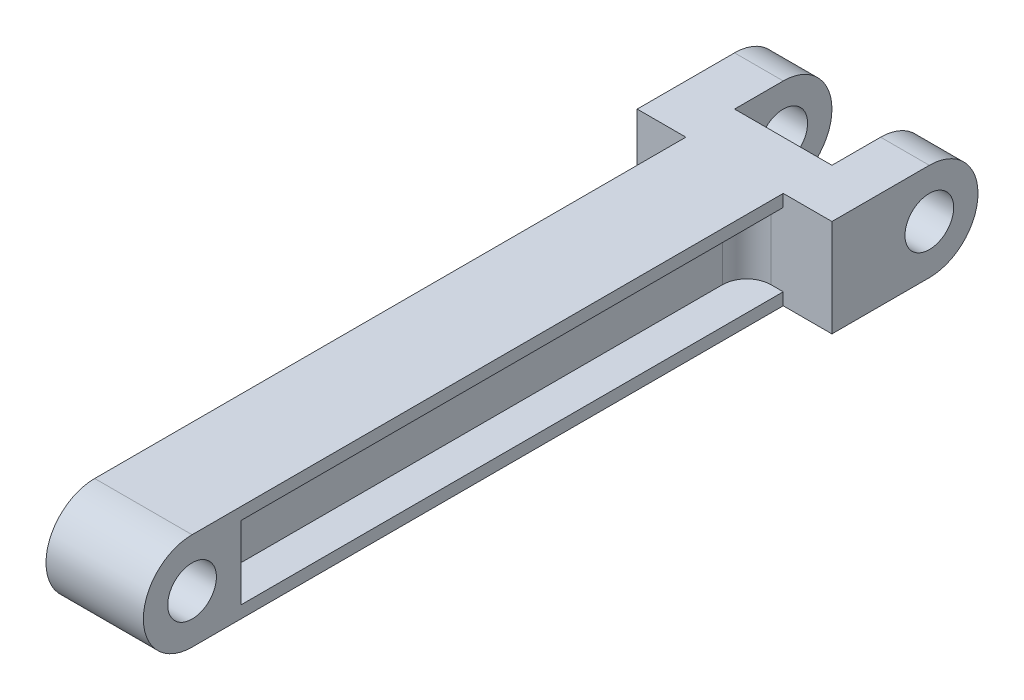
from build123d import *
from build123d.topology import SkipClean

# Parameters (mm, degrees)
SKETCH3_W           = 1.5875
SKETCH3_H           = 89.802561211
BOSS_EXTRUDE2_DEPTH = 12.7
BOSS_EXTRUDE4_DEPTH = 6.35
BOSS_EXTRUDE5_DEPTH = 12.7
BOSS_EXTRUDE6_START = -6.35
BOSS_EXTRUDE6_DEPTH = 6.35
CUT_EXTRUDE1_DEPTH  = 1.5875
SKETCH5_W           = 4.7625
SKETCH5_H           = 1.5875
BOSS_EXTRUDE7_DEPTH = 70.752561211
CUT_EXTRUDE2_DEPTH  = 12.7
FILLET1_R           = 3.175
FILLET2_R           = 3.175


# Read off the part's stored shape, not the designer's step: Mirror3
with BuildPart() as part:
    # Sketch3 → Boss-Extrude2 (new body)
    with BuildSketch(Plane(origin=(0, 0, 0), x_dir=(1, 0, 0), z_dir=(0, 1, 0))):
        with Locations((0.79375, 44.901280606)):
            Rectangle(SKETCH3_W, SKETCH3_H)
    extrude(amount=BOSS_EXTRUDE2_DEPTH)

    # Sketch4 → Boss-Extrude4 (add)
    with BuildSketch(Plane(origin=(1.5875, 0, 0), x_dir=(0, 0, -1), z_dir=(1, 0, 0))):
        with BuildLine():
            ThreePointArc((0, 0), (4.490128061, 1.859871939), (6.35, 6.35))
            ThreePointArc((6.35, 6.35), (4.490128061, 10.840128061), (0, 12.7))
            Line((0, 12.7), (0, 9.525))
            ThreePointArc((0, 9.525), (2.24506403, 8.59506403), (3.175, 6.35))
            ThreePointArc((3.175, 6.35), (2.24506403, 4.10493597), (0, 3.175))
            Line((0, 3.175), (0, 0))
        make_face()
        with BuildLine():
            Line((0, 9.525), (0, 12.7))
            ThreePointArc((0, 12.7), (-6.35, 6.35), (0, 0))
            Line((0, 0), (0, 3.175))
            ThreePointArc((0, 3.175), (-3.175, 6.35), (0, 9.525))
        make_face()
        with BuildLine():
            ThreePointArc((0, 0), (4.490128061, 1.859871939), (6.35, 6.35))
            ThreePointArc((6.35, 6.35), (4.490128061, 10.840128061), (0, 12.7))
            Line((0, 12.7), (0, 9.525))
            ThreePointArc((0, 9.525), (2.24506403, 8.59506403), (3.175, 6.35))
            ThreePointArc((3.175, 6.35), (2.24506403, 4.10493597), (0, 3.175))
            Line((0, 3.175), (0, 0))
        make_face()
        with BuildLine():
            Line((0, 9.525), (0, 12.7))
            ThreePointArc((0, 12.7), (-6.35, 6.35), (0, 0))
            Line((0, 0), (0, 3.175))
            ThreePointArc((0, 3.175), (-3.175, 6.35), (0, 9.525))
        make_face()
        with BuildLine():
            Line((6.35, 0), (6.35, 6.35))
            ThreePointArc((6.35, 6.35), (4.490128061, 1.859871939), (0, 0))
            Line((0, 0), (6.35, 0))
        make_face()
        with BuildLine():
            Line((6.35, 6.35), (6.35, 12.7))
            Line((6.35, 12.7), (0, 12.7))
            ThreePointArc((0, 12.7), (4.490128061, 10.840128061), (6.35, 6.35))
        make_face()
    extrude(amount=-BOSS_EXTRUDE4_DEPTH)

    # Sketch4<6> → Boss-Extrude5 (add)
    with BuildSketch(Plane(origin=(1.5875, 0, 0), x_dir=(0, 0, -1), z_dir=(1, 0, 0))):
        Polygon((83.452561211, 12.7), (77.102561211, 12.7), (77.102561211, 0), (83.452561211, 0), (83.452561211, 6.35), align=None)
    extrude(amount=-BOSS_EXTRUDE5_DEPTH)

    # Sketch4<7> → Boss-Extrude6 (add)
    with BuildSketch(Plane(origin=(1.5875, 0, 0), x_dir=(0, 0, -1), z_dir=(1, 0, 0)).offset(BOSS_EXTRUDE6_START)):
        with BuildLine():
            ThreePointArc((89.802561211, 12.7), (85.31243315, 10.840128061), (83.452561211, 6.35))
            ThreePointArc((83.452561211, 6.35), (85.31243315, 1.859871939), (89.802561211, 0))
            Line((89.802561211, 0), (89.802561211, 3.175))
            ThreePointArc((89.802561211, 3.175), (86.627561211, 6.35), (89.802561211, 9.525))
            Line((89.802561211, 9.525), (89.802561211, 12.7))
        make_face()
        with BuildLine():
            ThreePointArc((96.152561211, 6.35), (94.292689271, 10.840128061), (89.802561211, 12.7))
            Line((89.802561211, 12.7), (89.802561211, 9.525))
            ThreePointArc((89.802561211, 9.525), (92.047625241, 8.59506403), (92.977561211, 6.35))
            ThreePointArc((92.977561211, 6.35), (92.047625241, 4.10493597), (89.802561211, 3.175))
            Line((89.802561211, 3.175), (89.802561211, 0))
            ThreePointArc((89.802561211, 0), (94.292689271, 1.859871939), (96.152561211, 6.35))
        make_face()
        with BuildLine():
            ThreePointArc((89.802561211, 12.7), (85.31243315, 10.840128061), (83.452561211, 6.35))
            ThreePointArc((83.452561211, 6.35), (85.31243315, 1.859871939), (89.802561211, 0))
            Line((89.802561211, 0), (89.802561211, 3.175))
            ThreePointArc((89.802561211, 3.175), (86.627561211, 6.35), (89.802561211, 9.525))
            Line((89.802561211, 9.525), (89.802561211, 12.7))
        make_face()
        with BuildLine():
            ThreePointArc((96.152561211, 6.35), (94.292689271, 10.840128061), (89.802561211, 12.7))
            Line((89.802561211, 12.7), (89.802561211, 9.525))
            ThreePointArc((89.802561211, 9.525), (92.047625241, 8.59506403), (92.977561211, 6.35))
            ThreePointArc((92.977561211, 6.35), (92.047625241, 4.10493597), (89.802561211, 3.175))
            Line((89.802561211, 3.175), (89.802561211, 0))
            ThreePointArc((89.802561211, 0), (94.292689271, 1.859871939), (96.152561211, 6.35))
        make_face()
        with BuildLine():
            ThreePointArc((89.802561211, 0), (85.31243315, 1.859871939), (83.452561211, 6.35))
            Line((83.452561211, 6.35), (83.452561211, 0))
            Line((83.452561211, 0), (89.802561211, 0))
        make_face()
        with BuildLine():
            Line((89.802561211, 12.7), (83.452561211, 12.7))
            Line((83.452561211, 12.7), (83.452561211, 6.35))
            ThreePointArc((83.452561211, 6.35), (85.31243315, 10.840128061), (89.802561211, 12.7))
        make_face()
    extrude(amount=-BOSS_EXTRUDE6_DEPTH)

    # Sketch4<9> → Cut-Extrude1 (cut)
    with BuildSketch(Plane(origin=(1.5875, 0, 0), x_dir=(0, 0, -1), z_dir=(1, 0, 0))):
        with BuildLine():
            ThreePointArc((89.802561211, 0), (85.31243315, 1.859871939), (83.452561211, 6.35))
            Line((83.452561211, 6.35), (83.452561211, 0))
            Line((83.452561211, 0), (89.802561211, 0))
        make_face()
        with BuildLine():
            ThreePointArc((89.802561211, 12.7), (85.31243315, 10.840128061), (83.452561211, 6.35))
            ThreePointArc((83.452561211, 6.35), (85.31243315, 1.859871939), (89.802561211, 0))
            Line((89.802561211, 0), (89.802561211, 3.175))
            ThreePointArc((89.802561211, 3.175), (86.627561211, 6.35), (89.802561211, 9.525))
            Line((89.802561211, 9.525), (89.802561211, 12.7))
        make_face()
        with BuildLine():
            ThreePointArc((96.152561211, 6.35), (94.292689271, 10.840128061), (89.802561211, 12.7))
            Line((89.802561211, 12.7), (89.802561211, 9.525))
            ThreePointArc((89.802561211, 9.525), (92.047625241, 8.59506403), (92.977561211, 6.35))
            ThreePointArc((92.977561211, 6.35), (92.047625241, 4.10493597), (89.802561211, 3.175))
            Line((89.802561211, 3.175), (89.802561211, 0))
            ThreePointArc((89.802561211, 0), (94.292689271, 1.859871939), (96.152561211, 6.35))
        make_face()
        with BuildLine():
            Line((89.802561211, 12.7), (83.452561211, 12.7))
            Line((83.452561211, 12.7), (83.452561211, 6.35))
            ThreePointArc((83.452561211, 6.35), (85.31243315, 10.840128061), (89.802561211, 12.7))
        make_face()
    extrude(amount=-CUT_EXTRUDE1_DEPTH, mode=Mode.SUBTRACT)


with BuildPart() as cut_extrude1_kept_piece:
    # of the separate pieces the step leaves, the one the design keeps (cut_extrude1_pieces_kept)
    add(part.part.solids().sort_by_distance((1.5875, 0, 0))[0])

    # Sketch5 → Boss-Extrude7 (add)
    with BuildSketch(Plane(origin=(0, 0, -6.35), x_dir=(-1, 0, 0), z_dir=(0, 0, -1))):
        with Locations((2.38125, 11.90625)):
            Rectangle(SKETCH5_W, SKETCH5_H)
        with Locations((2.38125, 0.79375)):
            Rectangle(SKETCH5_W, SKETCH5_H)
    extrude(amount=BOSS_EXTRUDE7_DEPTH)

    # Sketch4<10> → Cut-Extrude2 (cut)
    with SkipClean():  # the faces are left unmerged after this step: merging them gives an invalid solid
        with BuildSketch(Plane(origin=(1.5875, 0, 0), x_dir=(0, 0, -1), z_dir=(1, 0, 0))):
            with BuildLine():
                ThreePointArc((3.175, 6.35), (2.24506403, 8.59506403), (0, 9.525))
                Line((0, 9.525), (0, 3.175))
                ThreePointArc((0, 3.175), (2.24506403, 4.10493597), (3.175, 6.35))
            make_face()
            with BuildLine():
                Line((0, 3.175), (0, 9.525))
                ThreePointArc((0, 9.525), (-3.175, 6.35), (0, 3.175))
            make_face()
        extrude(amount=-CUT_EXTRUDE2_DEPTH, mode=Mode.SUBTRACT)

    # Fillet1
    fillet1_edges = [cut_extrude1_kept_piece.edges().sort_by_distance(p)[0] for p in [
        (0, 6.35, -77.102561211),
    ]]
    fillet(fillet1_edges, radius=FILLET1_R)

    # Fillet2
    fillet2_edges = [cut_extrude1_kept_piece.edges().sort_by_distance(p)[0] for p in [
        (0, 6.35, -6.35),
    ]]
    fillet(fillet2_edges, radius=FILLET2_R)

    # Mirror3: Cut-Extrude1 kept piece across plane


with BuildPart() as cut_extrude1_kept_piece_1:
    with SkipClean():  # the faces are left unmerged after this step: merging them gives an invalid solid
        add(cut_extrude1_kept_piece.part)
        add(cut_extrude1_kept_piece.part.mirror(Plane(origin=(1.5875, 0, 0), x_dir=(0, 0, 1), z_dir=(1, 0, 0))))


solid = cut_extrude1_kept_piece_1.part
